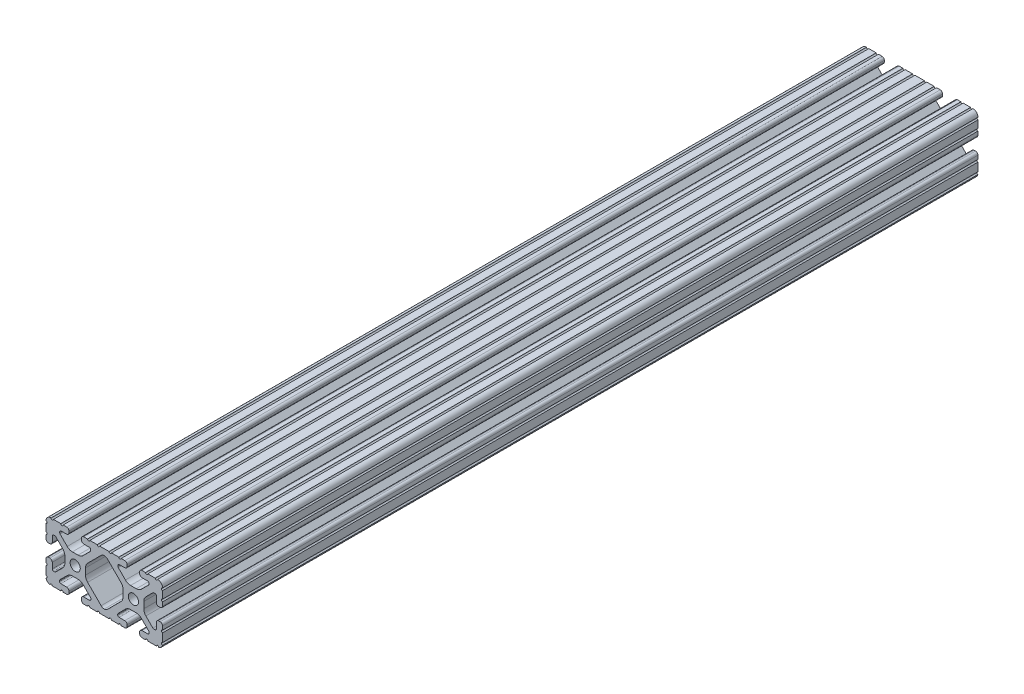
from build123d import *

# Parameters (mm, degrees)
SKETCH1_R      = 3.3274
EXTRUDE1_DEPTH = 533.4


with BuildPart() as part:
    # Sketch1 → Extrude1 (new body)
    with BuildSketch(Plane.XY):
        with BuildLine():
            Line((-3.121121376, -19.05), (3.121121376, -19.05))
            ThreePointArc((3.121121376, -19.05), (3.883121376, -18.288), (4.645121376, -19.05))
            Line((4.645121376, -19.05), (8.633115796, -19.05))
            Line((8.633115796, -19.05), (9.473536067, -19.05))
            ThreePointArc((9.473536067, -19.05), (10.235536067, -18.288), (10.997536067, -19.05))
            Line((10.997536067, -19.05), (13.4112, -19.05))
            ThreePointArc((13.4112, -19.05), (14.524751759, -18.588751759), (14.986, -17.4752))
            Line((14.986, -17.4752), (14.986, -16.5608))
            ThreePointArc((14.986, -16.5608), (14.524751759, -15.447248241), (13.4112, -14.986))
            Line((13.4112, -14.986), (9.652, -14.986))
            ThreePointArc((9.652, -14.986), (9.023382072, -14.725617928), (8.763, -14.097))
            Line((8.763, -14.097), (8.763, -13.687179678))
            ThreePointArc((8.763, -13.687179678), (8.830670671, -13.346975131), (9.023380503, -13.058563318))
            Line((9.023380503, -13.058563318), (13.852498595, -8.229421131))
            ThreePointArc((13.852498595, -8.229421131), (15.393447522, -7.199787805), (17.211122763, -6.838228541))
            Line((17.211122763, -6.838228541), (20.888877237, -6.838228541))
            ThreePointArc((20.888877237, -6.838228541), (22.706552478, -7.199787805), (24.247501405, -8.229421131))
            Line((24.247501405, -8.229421131), (29.076619497, -13.058563318))
            ThreePointArc((29.076619497, -13.058563318), (29.269329329, -13.346975131), (29.337, -13.687179678))
            Line((29.337, -13.687179678), (29.337, -14.097))
            ThreePointArc((29.337, -14.097), (29.076617928, -14.725617928), (28.448, -14.986))
            Line((28.448, -14.986), (24.6888, -14.986))
            ThreePointArc((24.6888, -14.986), (23.575248241, -15.447248241), (23.114, -16.5608))
            Line((23.114, -16.5608), (23.114, -17.4752))
            ThreePointArc((23.114, -17.4752), (23.575248241, -18.588751759), (24.6888, -19.05))
            Line((24.6888, -19.05), (26.945817469, -19.05))
            ThreePointArc((26.945817469, -19.05), (27.707817469, -18.288), (28.469817469, -19.05))
            Line((28.469817469, -19.05), (29.207115796, -19.05))
            Line((29.207115796, -19.05), (34.047273398, -19.05))
            ThreePointArc((34.047273398, -19.05), (34.809273398, -18.288), (35.571273398, -19.05))
            ThreePointArc((35.571273398, -19.05), (37.207577603, -18.182738167), (38.1, -16.560019212))
            ThreePointArc((38.1, -16.560019212), (37.338, -15.798019212), (38.1, -15.036019212))
            Line((38.1, -15.036019212), (38.1, -10.287))
            Line((38.1, -10.287), (38.1, -9.549701672))
            ThreePointArc((38.1, -9.549701672), (37.338, -8.787701672), (38.1, -8.025701672))
            Line((38.1, -8.025701672), (38.1, -5.6388))
            ThreePointArc((38.1, -5.6388), (37.638751759, -4.525248241), (36.5252, -4.064))
            Line((36.5252, -4.064), (35.6108, -4.064))
            ThreePointArc((35.6108, -4.064), (34.497248241, -4.525248241), (34.036, -5.6388))
            Line((34.036, -5.6388), (34.036, -9.398))
            ThreePointArc((34.036, -9.398), (33.775617928, -10.026617928), (33.147, -10.287))
            Line((33.147, -10.287), (32.420656743, -10.287))
            ThreePointArc((32.420656743, -10.287), (32.080450147, -10.21932848), (31.792037247, -10.02661636))
            Line((31.792037247, -10.02661636), (27.197575832, -5.43213202))
            ThreePointArc((27.197575832, -5.43213202), (26.167954729, -3.891188903), (25.8064, -2.07352461))
            Line((25.8064, -2.07352461), (25.8064, 2.07352461))
            ThreePointArc((25.8064, 2.07352461), (26.167954729, 3.891188903), (27.197575832, 5.43213202))
            Line((27.197575832, 5.43213202), (31.792037247, 10.02661636))
            ThreePointArc((31.792037247, 10.02661636), (32.080450147, 10.21932848), (32.420656743, 10.287))
            Line((32.420656743, 10.287), (33.147, 10.287))
            ThreePointArc((33.147, 10.287), (33.775617928, 10.026617928), (34.036, 9.398))
            Line((34.036, 9.398), (34.036, 5.6388))
            ThreePointArc((34.036, 5.6388), (34.497248241, 4.525248241), (35.6108, 4.064))
            Line((35.6108, 4.064), (36.5252, 4.064))
            ThreePointArc((36.5252, 4.064), (37.638751759, 4.525248241), (38.1, 5.6388))
            Line((38.1, 5.6388), (38.1, 8.025701672))
            ThreePointArc((38.1, 8.025701672), (37.338, 8.787701672), (38.1, 9.549701672))
            Line((38.1, 9.549701672), (38.1, 10.287))
            Line((38.1, 10.287), (38.1, 14.375206214))
            ThreePointArc((38.1, 14.375206214), (37.338232276, 15.156019383), (38.137614868, 15.89827725))
            ThreePointArc((38.137614868, 15.89827725), (37.148019028, 18.192014021), (34.819536496, 19.096833012))
            ThreePointArc((34.819536496, 19.096833012), (34.081312886, 18.311776389), (33.296256263, 19.05))
            Line((33.296256263, 19.05), (29.207115796, 19.05))
            Line((29.207115796, 19.05), (28.469817468, 19.05))
            ThreePointArc((28.469817468, 19.05), (27.707817468, 18.288), (26.945817468, 19.05))
            Line((26.945817468, 19.05), (24.558915796, 19.05))
            ThreePointArc((24.558915796, 19.05), (23.53023695, 18.547208069), (23.114, 17.480565346))
            Line((23.114, 17.480565346), (23.114, 16.5608))
            ThreePointArc((23.114, 16.5608), (23.575248241, 15.447248241), (24.6888, 14.986))
            Line((24.6888, 14.986), (28.295243665, 14.986))
            ThreePointArc((28.295243665, 14.986), (28.923861593, 14.725617928), (29.184243665, 14.097))
            Line((29.184243665, 14.097), (29.184243665, 13.53442258))
            ThreePointArc((29.184243665, 13.53442258), (29.116572993, 13.194218033), (28.923863161, 12.90580622))
            Line((28.923863161, 12.90580622), (24.247501405, 8.229421131))
            ThreePointArc((24.247501405, 8.229421131), (22.706552478, 7.199787805), (20.888877237, 6.838228541))
            Line((20.888877237, 6.838228541), (17.211122763, 6.838228541))
            ThreePointArc((17.211122763, 6.838228541), (15.393447522, 7.199787805), (13.852498595, 8.229421131))
            Line((13.852498595, 8.229421131), (9.176136839, 12.90580622))
            ThreePointArc((9.176136839, 12.90580622), (8.983427007, 13.194218033), (8.915756335, 13.53442258))
            Line((8.915756335, 13.53442258), (8.915756335, 14.097))
            ThreePointArc((8.915756335, 14.097), (9.176138407, 14.725617928), (9.804756335, 14.986))
            Line((9.804756335, 14.986), (13.4112, 14.986))
            ThreePointArc((13.4112, 14.986), (14.524751759, 15.447248241), (14.986, 16.5608))
            Line((14.986, 16.5608), (14.986, 17.496772581))
            ThreePointArc((14.986, 17.496772581), (14.531070222, 18.595070222), (13.432772581, 19.05))
            Line((13.432772581, 19.05), (10.997536067, 19.05))
            ThreePointArc((10.997536067, 19.05), (10.235536067, 18.288), (9.473536067, 19.05))
            Line((9.473536067, 19.05), (8.633115796, 19.05))
            Line((8.633115796, 19.05), (4.645121376, 19.05))
            ThreePointArc((4.645121376, 19.05), (3.883121376, 18.288), (3.121121376, 19.05))
            Line((3.121121376, 19.05), (-3.121121376, 19.05))
            ThreePointArc((-3.121121376, 19.05), (-3.883121376, 18.288), (-4.645121376, 19.05))
            Line((-4.645121376, 19.05), (-8.633115796, 19.05))
            Line((-8.633115796, 19.05), (-9.473536067, 19.05))
            ThreePointArc((-9.473536067, 19.05), (-10.235536067, 18.288), (-10.997536067, 19.05))
            Line((-10.997536067, 19.05), (-13.432772581, 19.05))
            ThreePointArc((-13.432772581, 19.05), (-14.531070222, 18.595070222), (-14.986, 17.496772581))
            Line((-14.986, 17.496772581), (-14.986, 16.5608))
            ThreePointArc((-14.986, 16.5608), (-14.524751759, 15.447248241), (-13.4112, 14.986))
            Line((-13.4112, 14.986), (-9.804756335, 14.986))
            ThreePointArc((-9.804756335, 14.986), (-9.176138407, 14.725617928), (-8.915756335, 14.097))
            Line((-8.915756335, 14.097), (-8.915756335, 13.53442258))
            ThreePointArc((-8.915756335, 13.53442258), (-8.983427007, 13.194218033), (-9.176136839, 12.90580622))
            Line((-9.176136839, 12.90580622), (-13.852498595, 8.229421131))
            ThreePointArc((-13.852498595, 8.229421131), (-15.393447522, 7.199787805), (-17.211122763, 6.838228541))
            Line((-17.211122763, 6.838228541), (-20.888877237, 6.838228541))
            ThreePointArc((-20.888877237, 6.838228541), (-22.706552478, 7.199787805), (-24.247501405, 8.229421131))
            Line((-24.247501405, 8.229421131), (-28.923863161, 12.90580622))
            ThreePointArc((-28.923863161, 12.90580622), (-29.116572993, 13.194218033), (-29.184243665, 13.53442258))
            Line((-29.184243665, 13.53442258), (-29.184243665, 14.097))
            ThreePointArc((-29.184243665, 14.097), (-28.923861593, 14.725617928), (-28.295243665, 14.986))
            Line((-28.295243665, 14.986), (-24.6888, 14.986))
            ThreePointArc((-24.6888, 14.986), (-23.575248241, 15.447248241), (-23.114, 16.5608))
            Line((-23.114, 16.5608), (-23.114, 17.480565346))
            ThreePointArc((-23.114, 17.480565346), (-23.53023695, 18.547208069), (-24.558915796, 19.05))
            Line((-24.558915796, 19.05), (-26.945817468, 19.05))
            ThreePointArc((-26.945817468, 19.05), (-27.707817468, 18.288), (-28.469817468, 19.05))
            Line((-28.469817468, 19.05), (-29.207115796, 19.05))
            Line((-29.207115796, 19.05), (-33.296256263, 19.05))
            ThreePointArc((-33.296256263, 19.05), (-34.081312886, 18.311776389), (-34.819536496, 19.096833012))
            ThreePointArc((-34.819536496, 19.096833012), (-37.148019028, 18.192014021), (-38.137614868, 15.89827725))
            ThreePointArc((-38.137614868, 15.89827725), (-37.338232276, 15.156019383), (-38.1, 14.375206214))
            Line((-38.1, 14.375206214), (-38.1, 10.287))
            Line((-38.1, 10.287), (-38.1, 9.549701672))
            ThreePointArc((-38.1, 9.549701672), (-37.338, 8.787701672), (-38.1, 8.025701672))
            Line((-38.1, 8.025701672), (-38.1, 5.6388))
            ThreePointArc((-38.1, 5.6388), (-37.638751759, 4.525248241), (-36.5252, 4.064))
            Line((-36.5252, 4.064), (-35.6108, 4.064))
            ThreePointArc((-35.6108, 4.064), (-34.497248241, 4.525248241), (-34.036, 5.6388))
            Line((-34.036, 5.6388), (-34.036, 9.398))
            ThreePointArc((-34.036, 9.398), (-33.775617928, 10.026617928), (-33.147, 10.287))
            Line((-33.147, 10.287), (-32.420656743, 10.287))
            ThreePointArc((-32.420656743, 10.287), (-32.080450147, 10.21932848), (-31.792037247, 10.02661636))
            Line((-31.792037247, 10.02661636), (-27.197575832, 5.43213202))
            ThreePointArc((-27.197575832, 5.43213202), (-26.167954729, 3.891188903), (-25.8064, 2.07352461))
            Line((-25.8064, 2.07352461), (-25.8064, -2.07352461))
            ThreePointArc((-25.8064, -2.07352461), (-26.167954729, -3.891188903), (-27.197575832, -5.43213202))
            Line((-27.197575832, -5.43213202), (-31.792037247, -10.02661636))
            ThreePointArc((-31.792037247, -10.02661636), (-32.080450147, -10.21932848), (-32.420656743, -10.287))
            Line((-32.420656743, -10.287), (-33.147, -10.287))
            ThreePointArc((-33.147, -10.287), (-33.775617928, -10.026617928), (-34.036, -9.398))
            Line((-34.036, -9.398), (-34.036, -5.6388))
            ThreePointArc((-34.036, -5.6388), (-34.497248241, -4.525248241), (-35.6108, -4.064))
            Line((-35.6108, -4.064), (-36.5252, -4.064))
            ThreePointArc((-36.5252, -4.064), (-37.638751759, -4.525248241), (-38.1, -5.6388))
            Line((-38.1, -5.6388), (-38.1, -8.025701672))
            ThreePointArc((-38.1, -8.025701672), (-37.338, -8.787701672), (-38.1, -9.549701672))
            Line((-38.1, -9.549701672), (-38.1, -10.287))
            Line((-38.1, -10.287), (-38.1, -15.036019212))
            ThreePointArc((-38.1, -15.036019212), (-37.338, -15.798019212), (-38.1, -16.560019212))
            ThreePointArc((-38.1, -16.560019212), (-37.20882252, -18.184002456), (-35.571273398, -19.05))
            ThreePointArc((-35.571273398, -19.05), (-34.809273398, -18.288), (-34.047273398, -19.05))
            Line((-34.047273398, -19.05), (-29.207115796, -19.05))
            Line((-29.207115796, -19.05), (-28.469817469, -19.05))
            ThreePointArc((-28.469817469, -19.05), (-27.707817469, -18.288), (-26.945817469, -19.05))
            Line((-26.945817469, -19.05), (-24.6888, -19.05))
            ThreePointArc((-24.6888, -19.05), (-23.575248241, -18.588751759), (-23.114, -17.4752))
            Line((-23.114, -17.4752), (-23.114, -16.5608))
            ThreePointArc((-23.114, -16.5608), (-23.575248241, -15.447248241), (-24.6888, -14.986))
            Line((-24.6888, -14.986), (-28.448, -14.986))
            ThreePointArc((-28.448, -14.986), (-29.076617928, -14.725617928), (-29.337, -14.097))
            Line((-29.337, -14.097), (-29.337, -13.687179678))
            ThreePointArc((-29.337, -13.687179678), (-29.269329329, -13.346975131), (-29.076619497, -13.058563318))
            Line((-29.076619497, -13.058563318), (-24.247501405, -8.229421131))
            ThreePointArc((-24.247501405, -8.229421131), (-22.706552478, -7.199787805), (-20.888877237, -6.838228541))
            Line((-20.888877237, -6.838228541), (-17.211122763, -6.838228541))
            ThreePointArc((-17.211122763, -6.838228541), (-15.393447522, -7.199787805), (-13.852498595, -8.229421131))
            Line((-13.852498595, -8.229421131), (-9.023380503, -13.058563318))
            ThreePointArc((-9.023380503, -13.058563318), (-8.830670671, -13.346975131), (-8.763, -13.687179678))
            Line((-8.763, -13.687179678), (-8.763, -14.097))
            ThreePointArc((-8.763, -14.097), (-9.023382072, -14.725617928), (-9.652, -14.986))
            Line((-9.652, -14.986), (-13.4112, -14.986))
            ThreePointArc((-13.4112, -14.986), (-14.524751759, -15.447248241), (-14.986, -16.5608))
            Line((-14.986, -16.5608), (-14.986, -17.4752))
            ThreePointArc((-14.986, -17.4752), (-14.524751759, -18.588751759), (-13.4112, -19.05))
            Line((-13.4112, -19.05), (-10.997536067, -19.05))
            ThreePointArc((-10.997536067, -19.05), (-10.235536067, -18.288), (-9.473536067, -19.05))
            Line((-9.473536067, -19.05), (-8.633115796, -19.05))
            Line((-8.633115796, -19.05), (-4.645121376, -19.05))
            ThreePointArc((-4.645121376, -19.05), (-3.883121376, -18.288), (-3.121121376, -19.05))
        make_face()
        with Locations((19.05, 0)):
            Circle(SKETCH1_R, mode=Mode.SUBTRACT)
        with Locations((-19.05, 0)):
            Circle(SKETCH1_R, mode=Mode.SUBTRACT)
        with BuildLine():
            Line((2.077035361, 14.257564863), (10.902424168, 5.43213202))
            ThreePointArc((10.902424168, 5.43213202), (11.932045271, 3.891188903), (12.2936, 2.07352461))
            Line((12.2936, 2.07352461), (12.2936, -2.07352461))
            ThreePointArc((12.2936, -2.07352461), (11.932045271, -3.891188903), (10.902424168, -5.43213202))
            Line((10.902424168, -5.43213202), (2.077035361, -14.257564863))
            ThreePointArc((2.077035361, -14.257564863), (1.124045601, -14.892973012), (0, -15.113096807))
            ThreePointArc((0, -15.113096807), (-1.124045601, -14.892973012), (-2.077035361, -14.257564863))
            Line((-2.077035361, -14.257564863), (-10.902424168, -5.43213202))
            ThreePointArc((-10.902424168, -5.43213202), (-11.932045271, -3.891188903), (-12.2936, -2.07352461))
            Line((-12.2936, -2.07352461), (-12.2936, 2.07352461))
            ThreePointArc((-12.2936, 2.07352461), (-11.932045271, 3.891188903), (-10.902424168, 5.43213202))
            Line((-10.902424168, 5.43213202), (-2.077035361, 14.257564863))
            ThreePointArc((-2.077035361, 14.257564863), (-1.124045601, 14.892973012), (0, 15.113096807))
            ThreePointArc((0, 15.113096807), (1.124045601, 14.892973012), (2.077035361, 14.257564863))
        make_face(mode=Mode.SUBTRACT)
    extrude(amount=-EXTRUDE1_DEPTH)


solid = part.part
